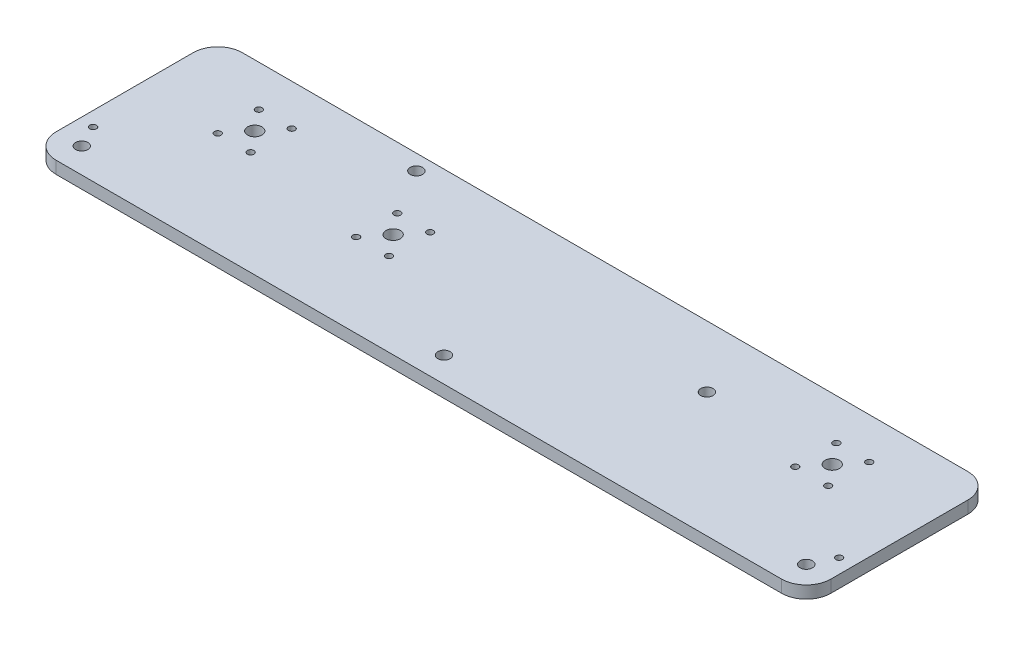
from build123d import *

# Parameters (mm, degrees)
ESBO_O1_R                = 3.5
ESBO_O1_R_2              = 3
ESBO_O1_R_3              = 1.6
RESSALTO_EXTRUS_O1_DEPTH = 6


with BuildPart() as part:
    # Esboço1 → Ressalto-extrusão1 (new body)
    with BuildSketch(Plane(origin=(0, 0, 0), x_dir=(1, 0, 0), z_dir=(0, 1, 0))):
        with BuildLine():
            Line((188.965018959, -38.648697641), (188.965018959, 28))
            ThreePointArc((188.965018959, 28), (185.450300333, 36.485281374), (176.965018959, 40))
            Line((176.965018959, 40), (-176.090826953, 40))
            ThreePointArc((-176.090826953, 40), (-184.576108327, 36.485281374), (-188.090826953, 28))
            Line((-188.090826953, 28), (-188.090826953, -38.648697641))
            ThreePointArc((-188.090826953, -38.648697641), (-184.576108327, -47.133979015), (-176.090826953, -50.648697641))
            Line((-176.090826953, -50.648697641), (176.965018959, -50.648697641))
            ThreePointArc((176.965018959, -50.648697641), (185.450300333, -47.133979015), (188.965018959, -38.648697641))
        make_face()
        with Locations((-62.734509176, 0)):
            Circle(ESBO_O1_R, mode=Mode.SUBTRACT)
        with Locations((176.748138959, -38.431817641)):
            Circle(ESBO_O1_R_2, mode=Mode.SUBTRACT)
        with Locations((0.437096003, -38.431817641)):
            Circle(ESBO_O1_R_2, mode=Mode.SUBTRACT)
        with Locations((79.965018959, 10)):
            Circle(ESBO_O1_R_2, mode=Mode.SUBTRACT)
        with Locations((-140.090826953, 10)):
            Circle(ESBO_O1_R, mode=Mode.SUBTRACT)
        with Locations((-148.090826953, 0)):
            Circle(ESBO_O1_R_3, mode=Mode.SUBTRACT)
        with Locations((-132.090826953, 0)):
            Circle(ESBO_O1_R_3, mode=Mode.SUBTRACT)
        with Locations((-132.090826953, 20)):
            Circle(ESBO_O1_R_3, mode=Mode.SUBTRACT)
        with Locations((-148.090826953, 20)):
            Circle(ESBO_O1_R_3, mode=Mode.SUBTRACT)
        with Locations((-70.734509176, -10)):
            Circle(ESBO_O1_R_3, mode=Mode.SUBTRACT)
        with Locations((-70.734509176, 10)):
            Circle(ESBO_O1_R_3, mode=Mode.SUBTRACT)
        with Locations((-54.734509176, 10)):
            Circle(ESBO_O1_R_3, mode=Mode.SUBTRACT)
        with Locations((-54.734509176, -10)):
            Circle(ESBO_O1_R_3, mode=Mode.SUBTRACT)
        with Locations((-83.930342624, 32.5)):
            Circle(ESBO_O1_R_2, mode=Mode.SUBTRACT)
        with Locations((-175.873946953, -38.431817641)):
            Circle(ESBO_O1_R_2, mode=Mode.SUBTRACT)
        with Locations((140.965018959, 10)):
            Circle(ESBO_O1_R, mode=Mode.SUBTRACT)
        with Locations((148.965018959, 0)):
            Circle(ESBO_O1_R_3, mode=Mode.SUBTRACT)
        with Locations((148.965018959, 20)):
            Circle(ESBO_O1_R_3, mode=Mode.SUBTRACT)
        with Locations((132.965018959, 0)):
            Circle(ESBO_O1_R_3, mode=Mode.SUBTRACT)
        with Locations((132.965018959, 20)):
            Circle(ESBO_O1_R_3, mode=Mode.SUBTRACT)
        with Locations((-181.090826953, -27.648697641)):
            Circle(ESBO_O1_R_3, mode=Mode.SUBTRACT)
        with Locations((181.965018959, -27.648697641)):
            Circle(ESBO_O1_R_3, mode=Mode.SUBTRACT)
    extrude(amount=-RESSALTO_EXTRUS_O1_DEPTH)


solid = part.part
